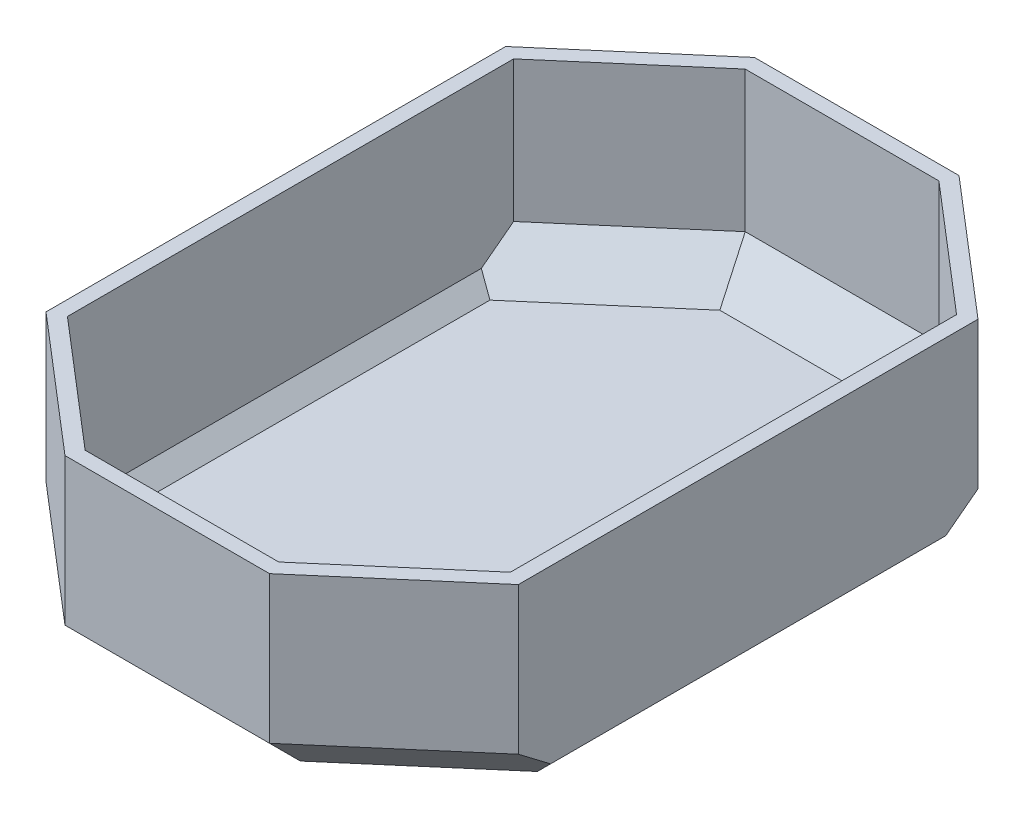
from build123d import *

# Parameters (mm, degrees)
BOSS_EXTRUDE1_DEPTH = 40
CHAMFER1_SIZE       = 10
CHAMFER2_SIZE       = 5
SHELL1_T            = -3


with BuildPart() as part:
    # Sketch1 → Boss-Extrude1 (new body)
    with BuildSketch(Plane(origin=(0, 0, 0), x_dir=(1, 0, 0), z_dir=(0, 1, 0))):
        Polygon((-20.883038336, 70.399520989), (-48.224748322, 46.933013992), (-48.224748322, -46.933013992), (-20.883038336, -70.399520989), (20.883038336, -70.399520989), (48.224748322, -46.933013992), (48.224748322, 46.933013992), (20.883038336, 70.399520989), align=None)
    extrude(amount=BOSS_EXTRUDE1_DEPTH)

    # Chamfer1
    chamfer1_edges = [part.edges().sort_by_distance(p)[0] for p in [
        (34.553893329, 0, -58.66626749),
        (0, 0, -70.399520989),
        (-34.553893329, 0, -58.66626749),
        (-34.553893329, 0, 58.66626749),
        (0, 0, 70.399520989),
        (34.553893329, 0, 58.66626749),
    ]]
    chamfer(chamfer1_edges, length=CHAMFER1_SIZE)

    # Chamfer2
    chamfer2_edges = [part.edges().sort_by_distance(p)[0] for p in [
        (-48.224748322, 0, 0),
        (48.224748322, 0, 0),
    ]]
    chamfer(chamfer2_edges, length=CHAMFER2_SIZE)

    # Shell1
    shell1_openings = [part.faces().sort_by_distance(p)[0] for p in [
        (0, 40, 0),
    ]]
    offset(amount=SHELL1_T, openings=shell1_openings, kind=Kind.INTERSECTION)


solid = part.part
